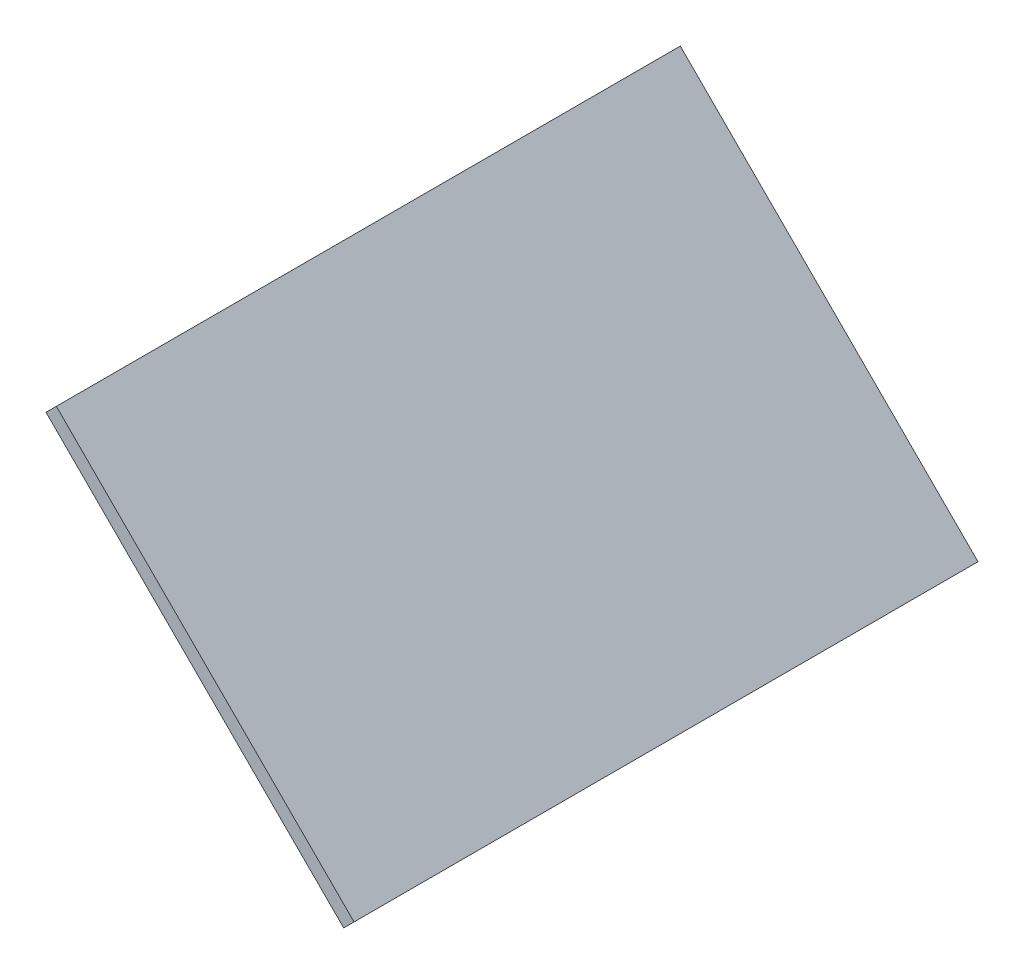
from build123d import *

# Parameters (mm, degrees)
BOSS_EXTRUDE1_DEPTH = 812.8


with BuildPart() as part:
    # Sketch1 → Boss-Extrude1 (new body)
    with BuildSketch(Plane.XY):
        Polygon((-140.28449825, 1456.145506581), (-126.814114068, 1469.615890762), (-514.615394673, 1857.417171368), (-528.085778855, 1843.946787186), align=None)
    extrude(amount=BOSS_EXTRUDE1_DEPTH)


solid = part.part
